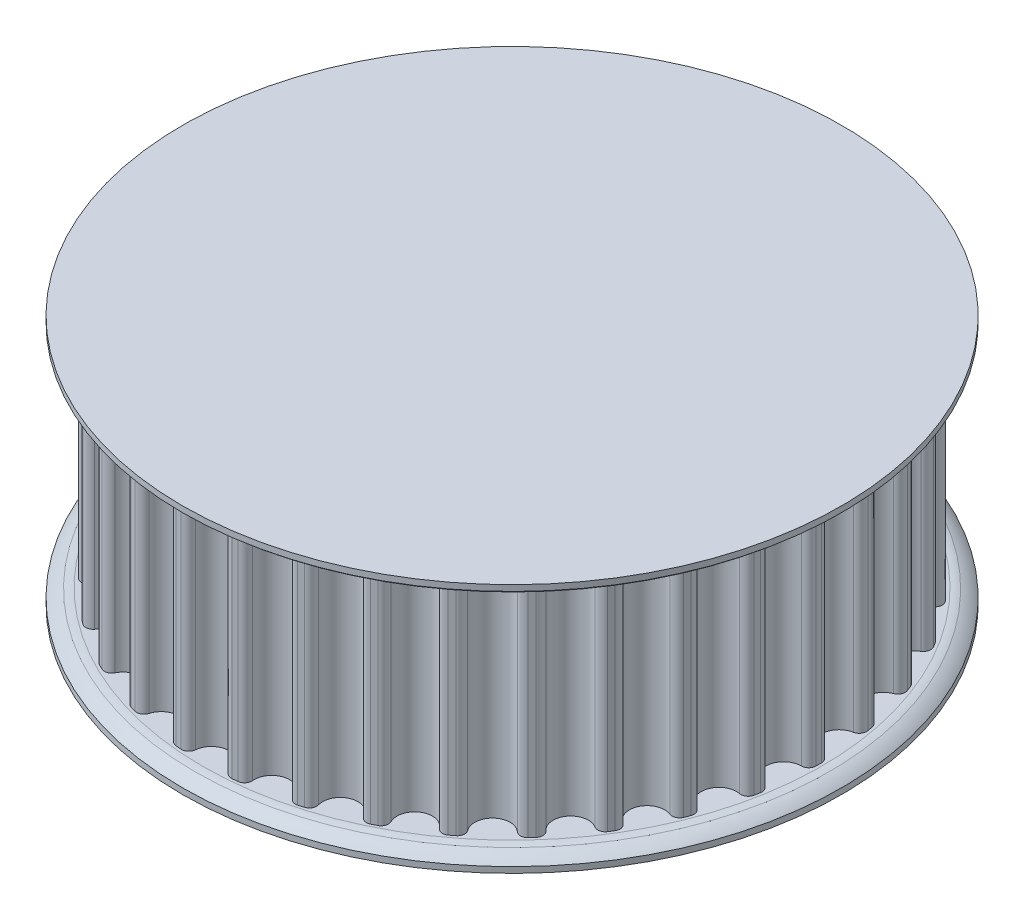
from build123d import *

# Parameters (mm, degrees)
SKETCH1_R               = 26.484839817
TOOTHOD_DEPTH           = 9.525
TOOTHPROFILE_DEPTH      = 43.021375278
TOOTHPATTERN_COUNT      = 34
LARGE_TOOTH_COUNT_DEPTH = 0.4


with BuildPart() as part:
    # Sketch1 → ToothOD (new, symmetric)
    with BuildSketch(Plane(origin=(0, 0, 0), x_dir=(1, 0, 0), z_dir=(0, 1, 0))):
        Circle(SKETCH1_R)
    extrude(amount=TOOTHOD_DEPTH, both=True)

    # Sketch2 → ToothProfile (cut, through all)
    with BuildSketch(Plane(origin=(0, 9.525, 0), x_dir=(1, 0, 0), z_dir=(0, 1, 0))):
        with BuildLine():
            ThreePointArc((-1.519107163, 25.8159054), (0, 24.424839817), (1.519107163, 25.8159054))
            ThreePointArc((1.519107163, 25.8159054), (1.742690761, 26.245908095), (2.204508681, 26.392932418))
            ThreePointArc((2.204508681, 26.392932418), (0, 26.484839817), (-2.204508681, 26.392932418))
            ThreePointArc((-2.204508681, 26.392932418), (-1.742690761, 26.245908095), (-1.519107163, 25.8159054))
        make_face()
    toothprofile = extrude(amount=-TOOTHPROFILE_DEPTH, mode=Mode.SUBTRACT)

    # ToothPattern: ToothProfile ×34 about axis
    toothpattern_axis = Axis((0, 9.525, 0), (0, -1, 0))
    for i in range(1, TOOTHPATTERN_COUNT):
        add(toothprofile.rotate(toothpattern_axis, i * 360 / TOOTHPATTERN_COUNT), mode=Mode.SUBTRACT)

    # Sketch4 → Flange (revolve)
    with BuildSketch(Plane.XY):
        with BuildLine():
            Line((0, -9.525), (26.738839817, -9.525))
            ThreePointArc((26.738839817, -9.525), (27.064595807, -9.550622571), (27.384412145, -9.617637424))
            ThreePointArc((27.384412145, -9.617637424), (27.952140722, -9.899197125), (28.453339817, -10.287))
            Line((28.453339817, -10.287), (28.453339817, -10.795))
            Line((28.453339817, -10.795), (0, -10.795))
            Line((0, -10.795), (0, -9.525))
        make_face()
        with BuildLine():
            Line((28.453339817, 10.795), (28.453339817, 10.287))
            ThreePointArc((28.453339817, 10.287), (27.952140722, 9.899197125), (27.384412145, 9.617637424))
            ThreePointArc((27.384412145, 9.617637424), (27.064595807, 9.550622571), (26.738839817, 9.525))
            Line((26.738839817, 9.525), (0, 9.525))
            Line((0, 9.525), (0, 10.795))
            Line((0, 10.795), (28.453339817, 10.795))
        make_face()
    revolve(axis=Axis((0, 12.09802, 0), (0, -1, 0)))

    # Sketch9 → Large Tooth Count (cut)
    # profile 1 of 2: a face of its own
    with BuildSketch(Plane(origin=(0, -10.795, 0), x_dir=(1, 0, 0), z_dir=(0, 1, 0))):
        with BuildLine():
            add(Edge.make_bspline(
                [(-2.903680392, 25.943753074), (-2.851306165, 25.951598605), (-2.749813536, 25.966801951), (-2.606342655, 26.01171696), (-2.477820869, 26.074829356), (-2.383034145, 26.141474043), (-2.31656786, 26.201818741), (-2.275403226, 26.251476626), (-2.241140048, 26.3035385), (-2.21373874, 26.358483075), (-2.194967795, 26.416915533), (-2.184535036, 26.478511543), (-2.180460317, 26.543000141), (-2.184542863, 26.586707653), (-2.186626485, 26.609014793)],
                knots=[0, 0, 0, 0, 1.740063961, 3.371957541, 4.92199819, 6.432353066, 7.166727857, 7.868735271, 8.547626388, 9.213184347, 9.881975106, 10.558036319, 11.264060488, 12, 12, 12, 12], degree=3))
            add(Edge.make_bspline(
                [(-2.186626485, 26.609014793), (-2.192736317, 26.642263395), (-2.204841324, 26.708136667), (-2.252304726, 26.799011284), (-2.320310586, 26.880039827), (-2.408886842, 26.949930675), (-2.515422148, 27.00569008), (-2.638369852, 27.040330812), (-2.775589729, 27.053435468), (-2.870665226, 27.046008843), (-2.920646798, 27.042104637)],
                knots=[0, 0, 0, 0, 0.852275953, 1.688558423, 2.561301801, 3.516320862, 4.52808515, 5.587637332, 6.731811224, 8, 8, 8, 8], degree=3))
            add(Edge.make_bspline(
                [(-2.920646798, 27.042104637), (-2.951994157, 27.038188089), (-3.011807649, 27.030714975), (-3.095504094, 27.011550945), (-3.169593717, 26.989796195), (-3.233557796, 26.96286107), (-3.289066622, 26.932002868), (-3.337685098, 26.89768825), (-3.380906258, 26.86063433), (-3.417778634, 26.81793884), (-3.450063255, 26.769000036), (-3.482679213, 26.713150464), (-3.514179092, 26.648093447), (-3.555840569, 26.552190943), (-3.604060115, 26.431428428), (-3.642458232, 26.335465549), (-3.660917892, 26.289331981)],
                knots=[0, 0, 0, 0, 1.160315134, 2.213982365, 3.151790119, 3.994987933, 4.758957526, 5.481299647, 6.179034099, 6.845898522, 7.546798871, 8.331097137, 9.221512484, 10.201198434, 12.17374933, 14, 14, 14, 14], degree=3))
            add(Edge.make_bspline(
                [(-3.660917892, 26.289331981), (-3.668534611, 26.277967871), (-3.684977223, 26.253435571), (-3.721124224, 26.221641179), (-3.767606688, 26.191248547), (-3.844463505, 26.15217931), (-3.955732123, 26.112847313), (-4.050506625, 26.097903768), (-4.099365548, 26.090199949)],
                knots=[0, 0, 0, 0, 0.496045838, 1.07084019, 1.734643886, 2.514462234, 4.203107176, 6, 6, 6, 6], degree=3))
            add(Edge.make_bspline(
                [(-4.099365548, 26.090199949), (-4.127672677, 26.088189931), (-4.183989265, 26.08419103), (-4.267936364, 26.098089151), (-4.350065974, 26.124298689), (-4.428141895, 26.164593018), (-4.498271748, 26.21797716), (-4.552765992, 26.286168199), (-4.589418709, 26.367042686), (-4.599550293, 26.425901454), (-4.60478586, 26.456317137)],
                knots=[0, 0, 0, 0, 0.977940017, 1.945596239, 2.918489561, 3.949288913, 4.968105422, 5.941868855, 6.936446263, 8, 8, 8, 8], degree=3))
            add(Edge.make_bspline(
                [(-4.60478586, 26.456317137), (-4.606775919, 26.486110091), (-4.610856114, 26.547194259), (-4.595834934, 26.640721121), (-4.566482452, 26.736563911), (-4.522574073, 26.834764286), (-4.46278021, 26.933421033), (-4.390906813, 27.03293457), (-4.302552849, 27.129442983), (-4.202213691, 27.225832499), (-4.087139141, 27.319087747), (-3.955632868, 27.404561535), (-3.809900724, 27.483859623), (-3.650050588, 27.556109603), (-3.477509856, 27.618964442), (-3.293530271, 27.671895273), (-3.098649622, 27.713200546), (-2.964252776, 27.730620438), (-2.895643673, 27.739513231)],
                knots=[0, 0, 0, 0, 0.615193234, 1.261323985, 1.942189662, 2.682672815, 3.476772768, 4.321740652, 5.214386911, 6.175566641, 7.194492884, 8.268961742, 9.410953063, 10.619103761, 11.889423795, 13.201172177, 14.571208534, 16, 16, 16, 16], degree=3))
            add(Edge.make_bspline(
                [(-2.895643673, 27.739513231), (-2.833197303, 27.746085135), (-2.710317374, 27.759017113), (-2.528303156, 27.762384205), (-2.352245231, 27.757212197), (-2.18283183, 27.73794683), (-2.020665313, 27.70910294), (-1.867401036, 27.66897625), (-1.723859739, 27.618180407), (-1.590947357, 27.556650947), (-1.469396723, 27.486373446), (-1.360883573, 27.408483822), (-1.267896333, 27.321522894), (-1.188711806, 27.228553019), (-1.124261168, 27.129415775), (-1.074647958, 27.025523218), (-1.038691012, 26.917512279), (-1.027112533, 26.842906365), (-1.021302267, 26.805467918)],
                knots=[0, 0, 0, 0, 1.300069987, 2.55823526, 3.767468252, 4.946070684, 6.086511357, 7.176729188, 8.223960215, 9.236362628, 10.206092186, 11.128569444, 11.996697351, 12.836671857, 13.652423912, 14.438389988, 15.216358985, 16, 16, 16, 16], degree=3))
            add(Edge.make_bspline(
                [(-1.021302267, 26.805467918), (-1.017578481, 26.756355014), (-1.010313851, 26.660542019), (-1.027337989, 26.518235116), (-1.066552162, 26.383153916), (-1.129979673, 26.256167794), (-1.211389041, 26.136496876), (-1.307908548, 26.021850221), (-1.418382054, 25.911247143), (-1.501897565, 25.845299323), (-1.544581954, 25.811593699)],
                knots=[0, 0, 0, 0, 1.000162013, 1.951188195, 2.897885184, 3.848564213, 4.826138591, 5.836498132, 6.894244279, 8, 8, 8, 8], degree=3))
            add(Edge.make_bspline(
                [(-1.544581954, 25.811593699), (-1.500581201, 25.800497205), (-1.412904133, 25.778386037), (-1.285794324, 25.730759634), (-1.161888538, 25.6747271), (-1.043897132, 25.608258693), (-0.93364112, 25.535355057), (-0.835725701, 25.455310031), (-0.74998693, 25.370887741), (-0.679255659, 25.279663303), (-0.620273948, 25.184804166), (-0.575703088, 25.084632349), (-0.542297605, 24.980489056), (-0.531850182, 24.908422929), (-0.526597579, 24.872190574)],
                knots=[0, 0, 0, 0, 1.106830422, 2.205499661, 3.307646583, 4.42331203, 5.507399246, 6.529767608, 7.505861233, 8.437462768, 9.340845248, 10.2253326, 11.10775866, 12, 12, 12, 12], degree=3))
            add(Edge.make_bspline(
                [(-0.526597579, 24.872190574), (-0.523375579, 24.828159752), (-0.516902938, 24.739706734), (-0.528014131, 24.604846644), (-0.559575, 24.469671252), (-0.606741198, 24.333716349), (-0.672011816, 24.199309267), (-0.757239888, 24.069125965), (-0.860489233, 23.942807992), (-0.981994193, 23.822458624), (-1.118055971, 23.707854566), (-1.27038989, 23.604437996), (-1.435934333, 23.509501627), (-1.615404427, 23.425133328), (-1.807514746, 23.351112635), (-2.012977096, 23.29365268), (-2.229119196, 23.244754624), (-2.378406311, 23.22553318), (-2.45451711, 23.215733543)],
                knots=[0, 0, 0, 0, 0.754708624, 1.516125596, 2.30452918, 3.124486451, 3.974216887, 4.854423338, 5.781222706, 6.760907303, 7.77700558, 8.821112307, 9.907167424, 11.039594138, 12.211684932, 13.425618924, 14.68750762, 16, 16, 16, 16], degree=3))
            add(Edge.make_bspline(
                [(-2.45451711, 23.215733543), (-2.529454186, 23.208616672), (-2.675833245, 23.194714862), (-2.891542398, 23.1938641), (-3.097101559, 23.210610301), (-3.291292499, 23.244294937), (-3.472355489, 23.293063828), (-3.640002099, 23.350745382), (-3.793377106, 23.418171009), (-3.93119574, 23.496356336), (-4.0545611, 23.58109826), (-4.163512071, 23.670823207), (-4.260455668, 23.762482706), (-4.340734539, 23.858547975), (-4.406557425, 23.952763957), (-4.456190477, 24.042505757), (-4.491508556, 24.12588394), (-4.501760616, 24.181089014), (-4.506559298, 24.206928856)],
                knots=[0, 0, 0, 0, 1.463170625, 2.858098436, 4.188112209, 5.468929361, 6.684760638, 7.830644877, 8.913749526, 9.937511587, 10.907227276, 11.820269891, 12.67990475, 13.497329856, 14.250330401, 14.910901878, 15.490225805, 16, 16, 16, 16], degree=3))
            add(Edge.make_bspline(
                [(-4.506559298, 24.206928856), (-4.508518078, 24.238583634), (-4.512318945, 24.300007368), (-4.490068441, 24.389614199), (-4.448149823, 24.471502358), (-4.38394304, 24.542290622), (-4.306273769, 24.603341581), (-4.216254774, 24.650833642), (-4.116971753, 24.685798095), (-4.046352596, 24.696258841), (-4.010068673, 24.701633543)],
                knots=[0, 0, 0, 0, 0.96845221, 1.879209172, 2.794491266, 3.765654484, 4.787287341, 5.813200375, 6.876428549, 8, 8, 8, 8], degree=3))
            add(Edge.make_bspline(
                [(-4.010068673, 24.701633543), (-3.986562796, 24.703806011), (-3.939847392, 24.708123558), (-3.869490842, 24.702429253), (-3.799443667, 24.691704973), (-3.732597269, 24.670698752), (-3.67165569, 24.64702383), (-3.620795793, 24.620227966), (-3.581063445, 24.591932077), (-3.563445705, 24.568410445), (-3.555547579, 24.557865574)],
                knots=[0, 0, 0, 0, 1.143228829, 2.272044512, 3.414086803, 4.574698632, 5.663540989, 6.581056788, 7.363880312, 8, 8, 8, 8], degree=3))
            add(Edge.make_bspline(
                [(-3.555547579, 24.557865574), (-3.535128513, 24.526534669), (-3.495550308, 24.465806084), (-3.435909325, 24.378562949), (-3.37613926, 24.299707203), (-3.31814652, 24.227309697), (-3.259900261, 24.163627702), (-3.204135254, 24.105470335), (-3.147484612, 24.056934), (-3.092708944, 24.013420069), (-3.035042054, 23.97814039), (-2.974402446, 23.948090678), (-2.908650473, 23.926372389), (-2.839686882, 23.90941739), (-2.767176595, 23.897281714), (-2.690609966, 23.893690433), (-2.610021165, 23.894040231), (-2.555098657, 23.899577994), (-2.526847579, 23.902426512)],
                knots=[0, 0, 0, 0, 1.373020529, 2.661320911, 3.8787029, 5.005136123, 6.065152844, 7.046546322, 7.960457092, 8.801984622, 9.611690243, 10.437677018, 11.280905751, 12.147600777, 13.044097102, 13.974583406, 14.958164784, 16, 16, 16, 16], degree=3))
            add(Edge.make_bspline(
                [(-2.526847579, 23.902426512), (-2.490395028, 23.907648975), (-2.418253984, 23.917984436), (-2.312625249, 23.946327215), (-2.21077193, 23.984901519), (-2.112701825, 24.032826403), (-2.020989929, 24.090035393), (-1.939239807, 24.157475067), (-1.867773928, 24.233368154), (-1.807340221, 24.31680936), (-1.758751726, 24.406606679), (-1.729802956, 24.502832517), (-1.71474827, 24.602771382), (-1.720332884, 24.670059679), (-1.723175704, 24.704312449)],
                knots=[0, 0, 0, 0, 1.051188026, 2.080342823, 3.116324303, 4.158255448, 5.193853031, 6.196534533, 7.177014501, 8.163485723, 9.133326721, 10.077290552, 11.021254384, 12, 12, 12, 12], degree=3))
            add(Edge.make_bspline(
                [(-1.723175704, 24.704312449), (-1.726915687, 24.729691617), (-1.734193648, 24.779079167), (-1.752050523, 24.850465422), (-1.776793218, 24.916934883), (-1.80971511, 24.977711892), (-1.846867472, 25.034841911), (-1.8920284, 25.085845068), (-1.943575513, 25.131543291), (-2.00056562, 25.173098115), (-2.06440847, 25.207169976), (-2.132361257, 25.237540902), (-2.206426912, 25.259085623), (-2.284768227, 25.276541484), (-2.368560869, 25.285972301), (-2.457157105, 25.289039381), (-2.551180947, 25.28793241), (-2.615286422, 25.281110611), (-2.648291329, 25.277598387)],
                knots=[0, 0, 0, 0, 0.999253927, 1.944535928, 2.862301611, 3.754796014, 4.633081324, 5.512591366, 6.399793507, 7.314033829, 8.253676566, 9.21476847, 10.209163103, 11.253453196, 12.339739852, 13.489041537, 14.707225048, 16, 16, 16, 16], degree=3))
            add(Edge.make_bspline(
                [(-2.648291329, 25.277598387), (-2.661383912, 25.27578839), (-2.691446524, 25.271632355), (-2.742324966, 25.265257054), (-2.803865472, 25.252319101), (-2.872810982, 25.240581323), (-2.940410552, 25.226869848), (-2.999045189, 25.218145429), (-3.043737488, 25.209171809), (-3.069162195, 25.205770626), (-3.079595235, 25.204374949)],
                knots=[0, 0, 0, 0, 0.725009898, 1.664735801, 2.811077102, 4.172056766, 5.500929595, 6.593335471, 7.422774529, 8, 8, 8, 8], degree=3))
            add(Edge.make_bspline(
                [(-3.079595235, 25.204374949), (-3.115287372, 25.20136448), (-3.183115205, 25.19564351), (-3.280826076, 25.201841697), (-3.368451735, 25.220038701), (-3.445423597, 25.251135131), (-3.510475303, 25.294557579), (-3.558875908, 25.352227923), (-3.594124682, 25.420447397), (-3.602225433, 25.471537972), (-3.606446798, 25.498161668)],
                knots=[0, 0, 0, 0, 1.264977471, 2.403909921, 3.448346349, 4.415715536, 5.323554311, 6.181920608, 7.052584676, 8, 8, 8, 8], degree=3))
            add(Edge.make_bspline(
                [(-3.606446798, 25.498161668), (-3.608124353, 25.525100407), (-3.611394467, 25.577613001), (-3.587590428, 25.653898629), (-3.545264953, 25.722942815), (-3.481444124, 25.782842329), (-3.399998249, 25.834719942), (-3.300420811, 25.875853294), (-3.184421111, 25.908251541), (-3.10063372, 25.91979602), (-3.056378048, 25.925893699)],
                knots=[0, 0, 0, 0, 0.827441055, 1.612958774, 2.421855522, 3.306085882, 4.290465572, 5.390228809, 6.621544631, 8, 8, 8, 8], degree=3))
            Line((-3.056378048, 25.925893699), (-2.903680392, 25.943753074))
        make_face()
    # profile 2 of 2: a face of its own
    with BuildSketch(Plane(origin=(0, -10.795, 0), x_dir=(1, 0, 0), z_dir=(0, 1, 0))):
        with BuildLine():
            Line((3.084861359, 23.598726733), (3.143797296, 24.076465014))
            Line((3.143797296, 24.076465014), (1.338214484, 24.298814233))
            add(Edge.make_bspline(
                [(1.338214484, 24.298814233), (1.308095108, 24.302940833), (1.249687214, 24.310943193), (1.16537298, 24.328190265), (1.087072534, 24.348184297), (1.014998447, 24.372705155), (0.948533054, 24.399774325), (0.888973905, 24.432378824), (0.834370179, 24.466840428), (0.787368557, 24.506516218), (0.745698381, 24.548162806), (0.71174645, 24.593721074), (0.682505307, 24.640780803), (0.661268177, 24.691522293), (0.645519327, 24.744471335), (0.638360473, 24.800127659), (0.634753141, 24.858182805), (0.638746903, 24.897415256), (0.64080589, 24.917641576)],
                knots=[0, 0, 0, 0, 1.387050356, 2.689786495, 3.925349453, 5.072307876, 6.16217894, 7.195380491, 8.167480071, 9.103212059, 9.996571896, 10.849675587, 11.690688719, 12.518320866, 13.352393828, 14.203440148, 15.073782162, 16, 16, 16, 16], degree=3))
            add(Edge.make_bspline(
                [(0.64080589, 24.917641576), (0.644829625, 24.940276874), (0.652902529, 24.985690546), (0.684861891, 25.050353895), (0.730392323, 25.111684159), (0.78743677, 25.171147471), (0.850594105, 25.227646946), (0.913510974, 25.283341204), (0.979472611, 25.331656404), (1.027115598, 25.356368736), (1.050678546, 25.368590795)],
                knots=[0, 0, 0, 0, 0.87358043, 1.752682682, 2.720649465, 3.781417633, 4.890940924, 5.954260625, 6.988231945, 8, 8, 8, 8], degree=3))
            Line((1.050678546, 25.368590795), (3.292923078, 27.241146264))
            add(Edge.make_bspline(
                [(3.292923078, 27.241146264), (3.328655314, 27.270680297), (3.395872649, 27.326237945), (3.494511509, 27.398841858), (3.580976611, 27.46049232), (3.659392785, 27.509877437), (3.736139372, 27.547548068), (3.817970823, 27.568595509), (3.905470821, 27.577013378), (3.965046555, 27.571633136), (3.995689484, 27.568865795)],
                knots=[0, 0, 0, 0, 1.387414161, 2.609920123, 3.665449418, 4.565571743, 5.382705264, 6.212660751, 7.080677559, 8, 8, 8, 8], degree=3))
            add(Edge.make_bspline(
                [(3.995689484, 27.568865795), (4.022828958, 27.565022311), (4.075291045, 27.557592646), (4.150501019, 27.541558487), (4.219879194, 27.521547871), (4.284071464, 27.499358648), (4.341796807, 27.470655849), (4.394502148, 27.440346016), (4.440887846, 27.404491659), (4.481976555, 27.365602754), (4.517161403, 27.322412365), (4.546075284, 27.275184669), (4.569201695, 27.22451526), (4.586322838, 27.169889164), (4.597783006, 27.111499412), (4.604004219, 27.049324103), (4.604050622, 26.983200831), (4.599178867, 26.938399796), (4.596657453, 26.91521267)],
                knots=[0, 0, 0, 0, 1.293784907, 2.500956951, 3.626265476, 4.701962078, 5.7012427, 6.665220317, 7.56740403, 8.461894478, 9.33096838, 10.188951889, 11.069312938, 11.953702097, 12.885176693, 13.87372914, 14.899531867, 16, 16, 16, 16], degree=3))
            Line((4.596657453, 26.91521267), (4.321623078, 24.68636267))
            Line((4.321623078, 24.68636267), (4.367164484, 24.681004858))
            add(Edge.make_bspline(
                [(4.367164484, 24.681004858), (4.416977233, 24.673903819), (4.512695914, 24.660258677), (4.649436255, 24.630308201), (4.772664008, 24.590863041), (4.866410349, 24.552284589), (4.933111444, 24.516803796), (4.9743273, 24.48513322), (5.009306941, 24.450321187), (5.035281389, 24.410205283), (5.054398323, 24.366782188), (5.065940548, 24.319394398), (5.070728142, 24.2681461), (5.067258311, 24.233019194), (5.065466046, 24.21487517)],
                knots=[0, 0, 0, 0, 1.923831321, 3.696776369, 5.345518056, 6.865582783, 7.568742625, 8.226685389, 8.846500593, 9.446343899, 10.042721126, 10.652844537, 11.304156739, 12, 12, 12, 12], degree=3))
            add(Edge.make_bspline(
                [(5.065466046, 24.21487517), (5.060016471, 24.186610455), (5.049322017, 24.131142698), (5.003811006, 24.057863809), (4.937268198, 23.999976568), (4.850938443, 23.957731682), (4.747172927, 23.928927042), (4.626277645, 23.91472785), (4.48918039, 23.914427872), (4.39300182, 23.924042716), (4.342161359, 23.92912517)],
                knots=[0, 0, 0, 0, 0.793575825, 1.557343504, 2.341617179, 3.213680132, 4.202200788, 5.318234146, 6.582405512, 8, 8, 8, 8], degree=3))
            Line((4.342161359, 23.92912517), (4.229647296, 23.94341267))
            Line((4.229647296, 23.94341267), (4.170711359, 23.465674389))
            add(Edge.make_bspline(
                [(4.170711359, 23.465674389), (4.164881025, 23.429518864), (4.153641665, 23.359820466), (4.11092165, 23.264976142), (4.05182001, 23.183919333), (3.974715915, 23.119247971), (3.88293725, 23.071482095), (3.778199619, 23.042035561), (3.661426004, 23.031701453), (3.580722238, 23.038729423), (3.538489484, 23.042407201)],
                knots=[0, 0, 0, 0, 1.018734417, 1.963853619, 2.873102283, 3.798912845, 4.746878028, 5.741216504, 6.817965341, 8, 8, 8, 8], degree=3))
            add(Edge.make_bspline(
                [(3.538489484, 23.042407201), (3.502533007, 23.048475792), (3.433114736, 23.060191929), (3.335921266, 23.094751845), (3.25214701, 23.146225524), (3.180497964, 23.210142672), (3.125791504, 23.289581072), (3.090235639, 23.382122727), (3.076541169, 23.487437904), (3.081991719, 23.560343127), (3.084861359, 23.598726733)],
                knots=[0, 0, 0, 0, 1.075825604, 2.077009714, 3.023841775, 3.963504641, 4.892580351, 5.844378418, 6.865094635, 8, 8, 8, 8], degree=3))
        make_face()
        Polygon((1.811487921, 24.994436889), (3.235773078, 24.819415014), (3.433119171, 26.419615014), align=None, mode=Mode.SUBTRACT)
    large_tooth_count = extrude(amount=LARGE_TOOTH_COUNT_DEPTH, mode=Mode.SUBTRACT)

    # Mirror1: Large Tooth Count across plane
    add(large_tooth_count.mirror(Plane.XY), mode=Mode.SUBTRACT)


solid = part.part
